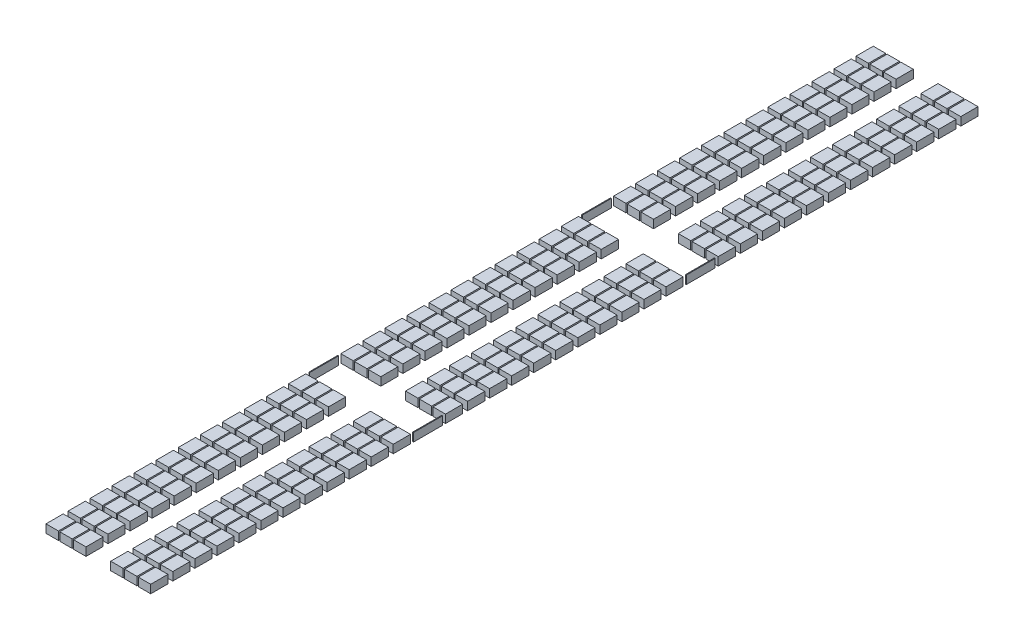
from build123d import *

# Parameters (mm, degrees)
SKETCH1_W             = 457.2
SKETCH1_H             = 635
SEATINGS_DEPTH        = 304.8
SKETCH2_W             = 30.48
SKETCH2_H             = 1066.8
BOSS_EXTRUDE1_DEPTH   = 304.8
BOSS_EXTRUDE1_2_DEPTH = 304.8
BOSS_EXTRUDE1_3_DEPTH = 304.8
BOSS_EXTRUDE1_4_DEPTH = 304.8


with BuildPart() as part:
    # Sketch1 → Seatings (new body)
    with BuildSketch(Plane(origin=(0, 0, 0), x_dir=(1, 0, 0), z_dir=(0, 1, 0))):
        with Locations((-1193.292, -14930.966666667)):
            Rectangle(SKETCH1_W, SKETCH1_H)
        with Locations((-1701.292, -14930.966666667)):
            Rectangle(SKETCH1_W, SKETCH1_H)
        with Locations((-685.292, -14930.966666667)):
            Rectangle(SKETCH1_W, SKETCH1_H)
        with Locations((-1193.292, -14118.166666667)):
            Rectangle(SKETCH1_W, SKETCH1_H)
        with Locations((-685.292, -14118.166666667)):
            Rectangle(SKETCH1_W, SKETCH1_H)
        with Locations((-1193.292, -13305.366666667)):
            Rectangle(SKETCH1_W, SKETCH1_H)
        with Locations((-685.292, -13305.366666667)):
            Rectangle(SKETCH1_W, SKETCH1_H)
        with Locations((-1701.292, -14118.166666667)):
            Rectangle(SKETCH1_W, SKETCH1_H)
        with Locations((-1701.292, -13305.366666667)):
            Rectangle(SKETCH1_W, SKETCH1_H)
        with Locations((-1701.292, -12492.566666667)):
            Rectangle(SKETCH1_W, SKETCH1_H)
        with Locations((-1193.292, -12492.566666667)):
            Rectangle(SKETCH1_W, SKETCH1_H)
        with Locations((-685.292, -12492.566666667)):
            Rectangle(SKETCH1_W, SKETCH1_H)
        with Locations((-1701.292, -11679.766666667)):
            Rectangle(SKETCH1_W, SKETCH1_H)
        with Locations((-1193.292, -11679.766666667)):
            Rectangle(SKETCH1_W, SKETCH1_H)
        with Locations((-685.292, -11679.766666667)):
            Rectangle(SKETCH1_W, SKETCH1_H)
        with Locations((-1701.292, -10866.966666667)):
            Rectangle(SKETCH1_W, SKETCH1_H)
        with Locations((-1193.292, -10866.966666667)):
            Rectangle(SKETCH1_W, SKETCH1_H)
        with Locations((-685.292, -10866.966666667)):
            Rectangle(SKETCH1_W, SKETCH1_H)
        with Locations((-1701.292, -10054.166666667)):
            Rectangle(SKETCH1_W, SKETCH1_H)
        with Locations((-1193.292, -10054.166666667)):
            Rectangle(SKETCH1_W, SKETCH1_H)
        with Locations((-685.292, -10054.166666667)):
            Rectangle(SKETCH1_W, SKETCH1_H)
        with Locations((-1701.292, -9241.366666667)):
            Rectangle(SKETCH1_W, SKETCH1_H)
        with Locations((-1193.292, -9241.366666667)):
            Rectangle(SKETCH1_W, SKETCH1_H)
        with Locations((-685.292, -9241.366666667)):
            Rectangle(SKETCH1_W, SKETCH1_H)
        with Locations((-1701.292, -8428.566666667)):
            Rectangle(SKETCH1_W, SKETCH1_H)
        with Locations((-1193.292, -8428.566666667)):
            Rectangle(SKETCH1_W, SKETCH1_H)
        with Locations((-685.292, -8428.566666667)):
            Rectangle(SKETCH1_W, SKETCH1_H)
        with Locations((-1701.292, -7615.766666667)):
            Rectangle(SKETCH1_W, SKETCH1_H)
        with Locations((-1193.292, -7615.766666667)):
            Rectangle(SKETCH1_W, SKETCH1_H)
        with Locations((-685.292, -7615.766666667)):
            Rectangle(SKETCH1_W, SKETCH1_H)
        with Locations((-1701.292, -6802.966666667)):
            Rectangle(SKETCH1_W, SKETCH1_H)
        with Locations((-1193.292, -6802.966666667)):
            Rectangle(SKETCH1_W, SKETCH1_H)
        with Locations((-685.292, -6802.966666667)):
            Rectangle(SKETCH1_W, SKETCH1_H)
        with Locations((-1701.292, -5990.166666667)):
            Rectangle(SKETCH1_W, SKETCH1_H)
        with Locations((-1193.292, -5990.166666667)):
            Rectangle(SKETCH1_W, SKETCH1_H)
        with Locations((-685.292, -5990.166666667)):
            Rectangle(SKETCH1_W, SKETCH1_H)
        with Locations((-1701.292, -4064)):
            Rectangle(SKETCH1_W, SKETCH1_H)
        with Locations((-1193.292, -4064)):
            Rectangle(SKETCH1_W, SKETCH1_H)
        with Locations((-685.292, -4064)):
            Rectangle(SKETCH1_W, SKETCH1_H)
        with Locations((-1193.292, -3251.2)):
            Rectangle(SKETCH1_W, SKETCH1_H)
        with Locations((-685.292, -3251.2)):
            Rectangle(SKETCH1_W, SKETCH1_H)
        with Locations((-1193.292, -2438.4)):
            Rectangle(SKETCH1_W, SKETCH1_H)
        with Locations((-685.292, -2438.4)):
            Rectangle(SKETCH1_W, SKETCH1_H)
        with Locations((-1193.292, -1625.6)):
            Rectangle(SKETCH1_W, SKETCH1_H)
        with Locations((-685.292, -1625.6)):
            Rectangle(SKETCH1_W, SKETCH1_H)
        with Locations((-1193.292, -812.8)):
            Rectangle(SKETCH1_W, SKETCH1_H)
        with Locations((-685.292, -812.8)):
            Rectangle(SKETCH1_W, SKETCH1_H)
        with Locations((-1701.292, -3251.2)):
            Rectangle(SKETCH1_W, SKETCH1_H)
        with Locations((-1701.292, -2438.4)):
            Rectangle(SKETCH1_W, SKETCH1_H)
        with Locations((-1701.292, -1625.6)):
            Rectangle(SKETCH1_W, SKETCH1_H)
        with Locations((-1701.292, -812.8)):
            Rectangle(SKETCH1_W, SKETCH1_H)
        with Locations((-1701.292, 0)):
            Rectangle(SKETCH1_W, SKETCH1_H)
        with Locations((-1193.292, 0)):
            Rectangle(SKETCH1_W, SKETCH1_H)
        with Locations((-685.292, 0)):
            Rectangle(SKETCH1_W, SKETCH1_H)
        with Locations((-1701.292, 812.8)):
            Rectangle(SKETCH1_W, SKETCH1_H)
        with Locations((-1193.292, 812.8)):
            Rectangle(SKETCH1_W, SKETCH1_H)
        with Locations((-685.292, 812.8)):
            Rectangle(SKETCH1_W, SKETCH1_H)
        with Locations((-1701.292, 1625.6)):
            Rectangle(SKETCH1_W, SKETCH1_H)
        with Locations((-1193.292, 1625.6)):
            Rectangle(SKETCH1_W, SKETCH1_H)
        with Locations((-685.292, 1625.6)):
            Rectangle(SKETCH1_W, SKETCH1_H)
        with Locations((-1701.292, 2438.4)):
            Rectangle(SKETCH1_W, SKETCH1_H)
        with Locations((-1193.292, 2438.4)):
            Rectangle(SKETCH1_W, SKETCH1_H)
        with Locations((-685.292, 2438.4)):
            Rectangle(SKETCH1_W, SKETCH1_H)
        with Locations((-1701.292, 3251.2)):
            Rectangle(SKETCH1_W, SKETCH1_H)
        with Locations((-1193.292, 3251.2)):
            Rectangle(SKETCH1_W, SKETCH1_H)
        with Locations((-685.292, 3251.2)):
            Rectangle(SKETCH1_W, SKETCH1_H)
        with Locations((-1701.292, 4064)):
            Rectangle(SKETCH1_W, SKETCH1_H)
        with Locations((-1193.292, 4064)):
            Rectangle(SKETCH1_W, SKETCH1_H)
        with Locations((-685.292, 4064)):
            Rectangle(SKETCH1_W, SKETCH1_H)
        with Locations((-685.292, 14930.966666667)):
            Rectangle(SKETCH1_W, SKETCH1_H)
        with Locations((-1193.292, 14930.966666667)):
            Rectangle(SKETCH1_W, SKETCH1_H)
        with Locations((-1701.292, 14930.966666667)):
            Rectangle(SKETCH1_W, SKETCH1_H)
        with Locations((-685.292, 5990.166666667)):
            Rectangle(SKETCH1_W, SKETCH1_H)
        with Locations((-1193.292, 5990.166666667)):
            Rectangle(SKETCH1_W, SKETCH1_H)
        with Locations((-1701.292, 5990.166666667)):
            Rectangle(SKETCH1_W, SKETCH1_H)
        with Locations((-685.292, 6802.966666667)):
            Rectangle(SKETCH1_W, SKETCH1_H)
        with Locations((-1193.292, 6802.966666667)):
            Rectangle(SKETCH1_W, SKETCH1_H)
        with Locations((-1701.292, 6802.966666667)):
            Rectangle(SKETCH1_W, SKETCH1_H)
        with Locations((-685.292, 7615.766666667)):
            Rectangle(SKETCH1_W, SKETCH1_H)
        with Locations((-1193.292, 7615.766666667)):
            Rectangle(SKETCH1_W, SKETCH1_H)
        with Locations((-1701.292, 7615.766666667)):
            Rectangle(SKETCH1_W, SKETCH1_H)
        with Locations((-685.292, 8428.566666667)):
            Rectangle(SKETCH1_W, SKETCH1_H)
        with Locations((-1193.292, 8428.566666667)):
            Rectangle(SKETCH1_W, SKETCH1_H)
        with Locations((-1701.292, 8428.566666667)):
            Rectangle(SKETCH1_W, SKETCH1_H)
        with Locations((-685.292, 9241.366666667)):
            Rectangle(SKETCH1_W, SKETCH1_H)
        with Locations((-1193.292, 9241.366666667)):
            Rectangle(SKETCH1_W, SKETCH1_H)
        with Locations((-1701.292, 9241.366666667)):
            Rectangle(SKETCH1_W, SKETCH1_H)
        with Locations((-685.292, 10054.166666667)):
            Rectangle(SKETCH1_W, SKETCH1_H)
        with Locations((-1193.292, 10054.166666667)):
            Rectangle(SKETCH1_W, SKETCH1_H)
        with Locations((-1701.292, 10054.166666667)):
            Rectangle(SKETCH1_W, SKETCH1_H)
        with Locations((-685.292, 10866.966666667)):
            Rectangle(SKETCH1_W, SKETCH1_H)
        with Locations((-1193.292, 10866.966666667)):
            Rectangle(SKETCH1_W, SKETCH1_H)
        with Locations((-1701.292, 10866.966666667)):
            Rectangle(SKETCH1_W, SKETCH1_H)
        with Locations((-685.292, 11679.766666667)):
            Rectangle(SKETCH1_W, SKETCH1_H)
        with Locations((-1193.292, 11679.766666667)):
            Rectangle(SKETCH1_W, SKETCH1_H)
        with Locations((-1701.292, 11679.766666667)):
            Rectangle(SKETCH1_W, SKETCH1_H)
        with Locations((-685.292, 12492.566666667)):
            Rectangle(SKETCH1_W, SKETCH1_H)
        with Locations((-1193.292, 12492.566666667)):
            Rectangle(SKETCH1_W, SKETCH1_H)
        with Locations((-1701.292, 12492.566666667)):
            Rectangle(SKETCH1_W, SKETCH1_H)
        with Locations((-1701.292, 13305.366666667)):
            Rectangle(SKETCH1_W, SKETCH1_H)
        with Locations((-1701.292, 14118.166666667)):
            Rectangle(SKETCH1_W, SKETCH1_H)
        with Locations((-685.292, 13305.366666667)):
            Rectangle(SKETCH1_W, SKETCH1_H)
        with Locations((-1193.292, 13305.366666667)):
            Rectangle(SKETCH1_W, SKETCH1_H)
        with Locations((-685.292, 14118.166666667)):
            Rectangle(SKETCH1_W, SKETCH1_H)
        with Locations((-1193.292, 14118.166666667)):
            Rectangle(SKETCH1_W, SKETCH1_H)
        with Locations((1193.292, 14930.966666667)):
            Rectangle(SKETCH1_W, SKETCH1_H)
        with Locations((1701.292, 14930.966666667)):
            Rectangle(SKETCH1_W, SKETCH1_H)
        with Locations((685.292, 14930.966666667)):
            Rectangle(SKETCH1_W, SKETCH1_H)
        with Locations((1193.292, 14118.166666667)):
            Rectangle(SKETCH1_W, SKETCH1_H)
        with Locations((685.292, 14118.166666667)):
            Rectangle(SKETCH1_W, SKETCH1_H)
        with Locations((1193.292, 13305.366666667)):
            Rectangle(SKETCH1_W, SKETCH1_H)
        with Locations((685.292, 13305.366666667)):
            Rectangle(SKETCH1_W, SKETCH1_H)
        with Locations((1701.292, 14118.166666667)):
            Rectangle(SKETCH1_W, SKETCH1_H)
        with Locations((1701.292, 13305.366666667)):
            Rectangle(SKETCH1_W, SKETCH1_H)
        with Locations((1701.292, 12492.566666667)):
            Rectangle(SKETCH1_W, SKETCH1_H)
        with Locations((1193.292, 12492.566666667)):
            Rectangle(SKETCH1_W, SKETCH1_H)
        with Locations((685.292, 12492.566666667)):
            Rectangle(SKETCH1_W, SKETCH1_H)
        with Locations((1701.292, 11679.766666667)):
            Rectangle(SKETCH1_W, SKETCH1_H)
        with Locations((1193.292, 11679.766666667)):
            Rectangle(SKETCH1_W, SKETCH1_H)
        with Locations((685.292, 11679.766666667)):
            Rectangle(SKETCH1_W, SKETCH1_H)
        with Locations((1701.292, 10866.966666667)):
            Rectangle(SKETCH1_W, SKETCH1_H)
        with Locations((1193.292, 10866.966666667)):
            Rectangle(SKETCH1_W, SKETCH1_H)
        with Locations((685.292, 10866.966666667)):
            Rectangle(SKETCH1_W, SKETCH1_H)
        with Locations((1701.292, 10054.166666667)):
            Rectangle(SKETCH1_W, SKETCH1_H)
        with Locations((1193.292, 10054.166666667)):
            Rectangle(SKETCH1_W, SKETCH1_H)
        with Locations((685.292, 10054.166666667)):
            Rectangle(SKETCH1_W, SKETCH1_H)
        with Locations((1701.292, 9241.366666667)):
            Rectangle(SKETCH1_W, SKETCH1_H)
        with Locations((1193.292, 9241.366666667)):
            Rectangle(SKETCH1_W, SKETCH1_H)
        with Locations((685.292, 9241.366666667)):
            Rectangle(SKETCH1_W, SKETCH1_H)
        with Locations((1701.292, 8428.566666667)):
            Rectangle(SKETCH1_W, SKETCH1_H)
        with Locations((1193.292, 8428.566666667)):
            Rectangle(SKETCH1_W, SKETCH1_H)
        with Locations((685.292, 8428.566666667)):
            Rectangle(SKETCH1_W, SKETCH1_H)
        with Locations((1701.292, 7615.766666667)):
            Rectangle(SKETCH1_W, SKETCH1_H)
        with Locations((1193.292, 7615.766666667)):
            Rectangle(SKETCH1_W, SKETCH1_H)
        with Locations((685.292, 7615.766666667)):
            Rectangle(SKETCH1_W, SKETCH1_H)
        with Locations((1701.292, 6802.966666667)):
            Rectangle(SKETCH1_W, SKETCH1_H)
        with Locations((1193.292, 6802.966666667)):
            Rectangle(SKETCH1_W, SKETCH1_H)
        with Locations((685.292, 6802.966666667)):
            Rectangle(SKETCH1_W, SKETCH1_H)
        with Locations((1701.292, 5990.166666667)):
            Rectangle(SKETCH1_W, SKETCH1_H)
        with Locations((1193.292, 5990.166666667)):
            Rectangle(SKETCH1_W, SKETCH1_H)
        with Locations((685.292, 5990.166666667)):
            Rectangle(SKETCH1_W, SKETCH1_H)
        with Locations((685.292, 4064)):
            Rectangle(SKETCH1_W, SKETCH1_H)
        with Locations((1193.292, 4064)):
            Rectangle(SKETCH1_W, SKETCH1_H)
        with Locations((1701.292, 4064)):
            Rectangle(SKETCH1_W, SKETCH1_H)
        with Locations((685.292, 3251.2)):
            Rectangle(SKETCH1_W, SKETCH1_H)
        with Locations((1193.292, 3251.2)):
            Rectangle(SKETCH1_W, SKETCH1_H)
        with Locations((1701.292, 3251.2)):
            Rectangle(SKETCH1_W, SKETCH1_H)
        with Locations((685.292, 2438.4)):
            Rectangle(SKETCH1_W, SKETCH1_H)
        with Locations((1193.292, 2438.4)):
            Rectangle(SKETCH1_W, SKETCH1_H)
        with Locations((1701.292, 2438.4)):
            Rectangle(SKETCH1_W, SKETCH1_H)
        with Locations((685.292, 1625.6)):
            Rectangle(SKETCH1_W, SKETCH1_H)
        with Locations((1193.292, 1625.6)):
            Rectangle(SKETCH1_W, SKETCH1_H)
        with Locations((1701.292, 1625.6)):
            Rectangle(SKETCH1_W, SKETCH1_H)
        with Locations((685.292, 812.8)):
            Rectangle(SKETCH1_W, SKETCH1_H)
        with Locations((1193.292, 812.8)):
            Rectangle(SKETCH1_W, SKETCH1_H)
        with Locations((1701.292, 812.8)):
            Rectangle(SKETCH1_W, SKETCH1_H)
        with Locations((685.292, 0)):
            Rectangle(SKETCH1_W, SKETCH1_H)
        with Locations((1193.292, 0)):
            Rectangle(SKETCH1_W, SKETCH1_H)
        with Locations((1701.292, 0)):
            Rectangle(SKETCH1_W, SKETCH1_H)
        with Locations((1701.292, -812.8)):
            Rectangle(SKETCH1_W, SKETCH1_H)
        with Locations((1701.292, -1625.6)):
            Rectangle(SKETCH1_W, SKETCH1_H)
        with Locations((1701.292, -2438.4)):
            Rectangle(SKETCH1_W, SKETCH1_H)
        with Locations((1701.292, -3251.2)):
            Rectangle(SKETCH1_W, SKETCH1_H)
        with Locations((685.292, -812.8)):
            Rectangle(SKETCH1_W, SKETCH1_H)
        with Locations((1193.292, -812.8)):
            Rectangle(SKETCH1_W, SKETCH1_H)
        with Locations((685.292, -1625.6)):
            Rectangle(SKETCH1_W, SKETCH1_H)
        with Locations((1193.292, -1625.6)):
            Rectangle(SKETCH1_W, SKETCH1_H)
        with Locations((685.292, -2438.4)):
            Rectangle(SKETCH1_W, SKETCH1_H)
        with Locations((1193.292, -2438.4)):
            Rectangle(SKETCH1_W, SKETCH1_H)
        with Locations((685.292, -3251.2)):
            Rectangle(SKETCH1_W, SKETCH1_H)
        with Locations((1193.292, -3251.2)):
            Rectangle(SKETCH1_W, SKETCH1_H)
        with Locations((685.292, -4064)):
            Rectangle(SKETCH1_W, SKETCH1_H)
        with Locations((1193.292, -4064)):
            Rectangle(SKETCH1_W, SKETCH1_H)
        with Locations((1701.292, -4064)):
            Rectangle(SKETCH1_W, SKETCH1_H)
        with Locations((685.292, -5990.166666667)):
            Rectangle(SKETCH1_W, SKETCH1_H)
        with Locations((1193.292, -5990.166666667)):
            Rectangle(SKETCH1_W, SKETCH1_H)
        with Locations((1701.292, -5990.166666667)):
            Rectangle(SKETCH1_W, SKETCH1_H)
        with Locations((685.292, -6802.966666667)):
            Rectangle(SKETCH1_W, SKETCH1_H)
        with Locations((1193.292, -6802.966666667)):
            Rectangle(SKETCH1_W, SKETCH1_H)
        with Locations((1701.292, -6802.966666667)):
            Rectangle(SKETCH1_W, SKETCH1_H)
        with Locations((685.292, -7615.766666667)):
            Rectangle(SKETCH1_W, SKETCH1_H)
        with Locations((1193.292, -7615.766666667)):
            Rectangle(SKETCH1_W, SKETCH1_H)
        with Locations((1701.292, -7615.766666667)):
            Rectangle(SKETCH1_W, SKETCH1_H)
        with Locations((685.292, -8428.566666667)):
            Rectangle(SKETCH1_W, SKETCH1_H)
        with Locations((1193.292, -8428.566666667)):
            Rectangle(SKETCH1_W, SKETCH1_H)
        with Locations((1701.292, -8428.566666667)):
            Rectangle(SKETCH1_W, SKETCH1_H)
        with Locations((685.292, -9241.366666667)):
            Rectangle(SKETCH1_W, SKETCH1_H)
        with Locations((1193.292, -9241.366666667)):
            Rectangle(SKETCH1_W, SKETCH1_H)
        with Locations((1701.292, -9241.366666667)):
            Rectangle(SKETCH1_W, SKETCH1_H)
        with Locations((685.292, -10054.166666667)):
            Rectangle(SKETCH1_W, SKETCH1_H)
        with Locations((1193.292, -10054.166666667)):
            Rectangle(SKETCH1_W, SKETCH1_H)
        with Locations((1701.292, -10054.166666667)):
            Rectangle(SKETCH1_W, SKETCH1_H)
        with Locations((685.292, -10866.966666667)):
            Rectangle(SKETCH1_W, SKETCH1_H)
        with Locations((1193.292, -10866.966666667)):
            Rectangle(SKETCH1_W, SKETCH1_H)
        with Locations((1701.292, -10866.966666667)):
            Rectangle(SKETCH1_W, SKETCH1_H)
        with Locations((685.292, -11679.766666667)):
            Rectangle(SKETCH1_W, SKETCH1_H)
        with Locations((1193.292, -11679.766666667)):
            Rectangle(SKETCH1_W, SKETCH1_H)
        with Locations((1701.292, -11679.766666667)):
            Rectangle(SKETCH1_W, SKETCH1_H)
        with Locations((685.292, -12492.566666667)):
            Rectangle(SKETCH1_W, SKETCH1_H)
        with Locations((1193.292, -12492.566666667)):
            Rectangle(SKETCH1_W, SKETCH1_H)
        with Locations((1701.292, -12492.566666667)):
            Rectangle(SKETCH1_W, SKETCH1_H)
        with Locations((1701.292, -13305.366666667)):
            Rectangle(SKETCH1_W, SKETCH1_H)
        with Locations((1701.292, -14118.166666667)):
            Rectangle(SKETCH1_W, SKETCH1_H)
        with Locations((685.292, -13305.366666667)):
            Rectangle(SKETCH1_W, SKETCH1_H)
        with Locations((1193.292, -13305.366666667)):
            Rectangle(SKETCH1_W, SKETCH1_H)
        with Locations((685.292, -14118.166666667)):
            Rectangle(SKETCH1_W, SKETCH1_H)
        with Locations((1193.292, -14118.166666667)):
            Rectangle(SKETCH1_W, SKETCH1_H)
        with Locations((685.292, -14930.966666667)):
            Rectangle(SKETCH1_W, SKETCH1_H)
        with Locations((1193.292, -14930.966666667)):
            Rectangle(SKETCH1_W, SKETCH1_H)
        with Locations((1701.292, -14930.966666667)):
            Rectangle(SKETCH1_W, SKETCH1_H)
    extrude(amount=SEATINGS_DEPTH)


with BuildPart() as body_2:
    # Sketch2 → Boss-Extrude1 (new body)
    with BuildSketch(Plane(origin=(0, 0, 0), x_dir=(1, 0, 0), z_dir=(0, 1, 0))):
        with Locations((-1914.652, 5027.083333333)):
            Rectangle(SKETCH2_W, SKETCH2_H)
    extrude(amount=BOSS_EXTRUDE1_DEPTH)


with BuildPart() as body_3:
    # Sketch2 → Boss-Extrude1 2 (new body)
    with BuildSketch(Plane(origin=(0, 0, 0), x_dir=(1, 0, 0), z_dir=(0, 1, 0))):
        with Locations((1914.652, 5027.083333333)):
            Rectangle(SKETCH2_W, SKETCH2_H)
    extrude(amount=BOSS_EXTRUDE1_2_DEPTH)


with BuildPart() as body_4:
    # Sketch2 → Boss-Extrude1 3 (new body)
    with BuildSketch(Plane(origin=(0, 0, 0), x_dir=(1, 0, 0), z_dir=(0, 1, 0))):
        with Locations((1914.652, -5027.083333333)):
            Rectangle(SKETCH2_W, SKETCH2_H)
    extrude(amount=BOSS_EXTRUDE1_3_DEPTH)


with BuildPart() as body_5:
    # Sketch2 → Boss-Extrude1 4 (new body)
    with BuildSketch(Plane(origin=(0, 0, 0), x_dir=(1, 0, 0), z_dir=(0, 1, 0))):
        with Locations((-1914.652, -5027.083333333)):
            Rectangle(SKETCH2_W, SKETCH2_H)
    extrude(amount=BOSS_EXTRUDE1_4_DEPTH)


solid = Compound([part.part, body_2.part, body_3.part, body_4.part, body_5.part])
